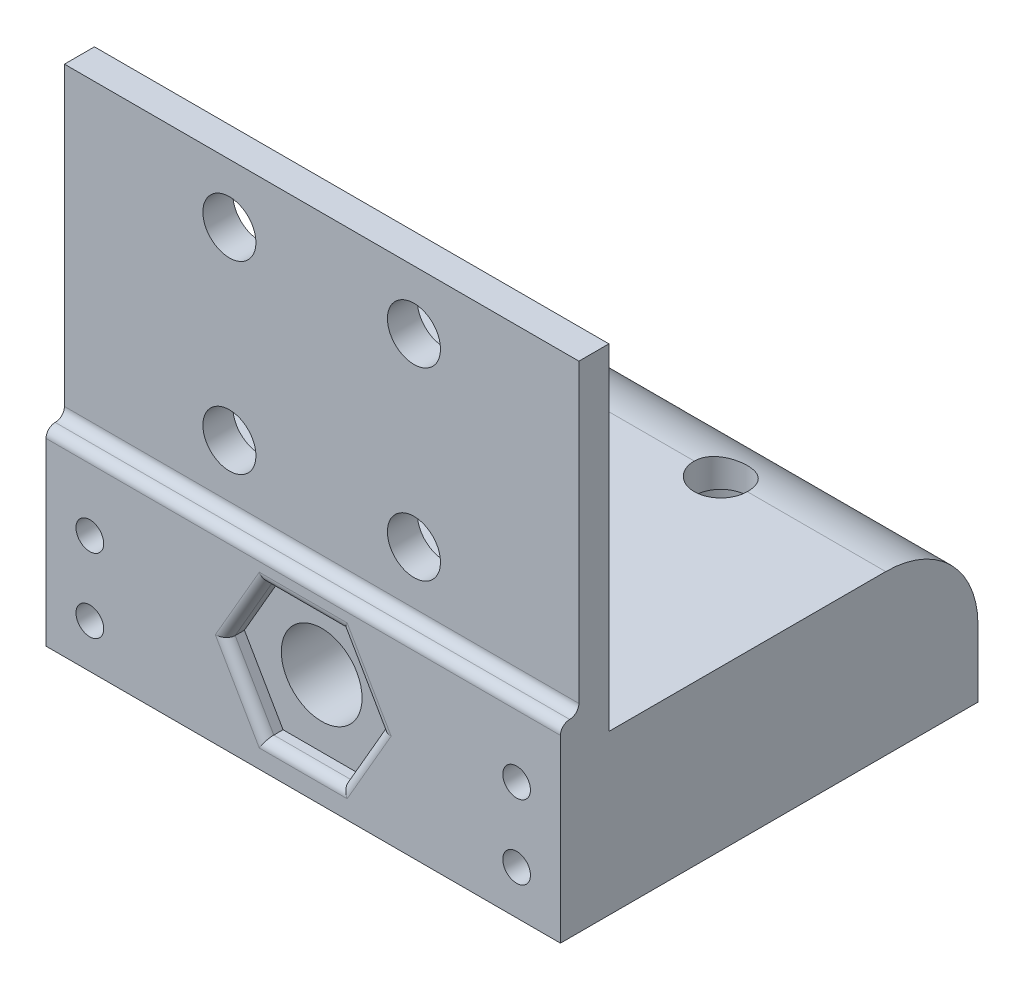
from build123d import *
from build123d.topology import SkipClean

# Parameters (mm, degrees)
SKETCH1_R           = 2.875
SKETCH1_W           = 55.75
SKETCH1_H           = 3.25
BOSS_EXTRUDE1_DEPTH = 3.25
SKETCH1_4_W         = 55.75
SKETCH1_4_H         = 3.25
BOSS_EXTRUDE2_DEPTH = 40
CUT_EXTRUDE2_DEPTH  = 43.25
BOSS_EXTRUDE4_DEPTH = 2
BOSS_EXTRUDE5_DEPTH = 43.25
SKETCH2_R           = 5
SKETCH2_R_2         = 2.875
CUT_EXTRUDE1_DEPTH  = 17.25
FILLET1_R           = 1
SKETCH2_3_R         = 5
SKETCH2_3_R_2       = 2.875
BOSS_EXTRUDE6_DEPTH = 3.25
SKETCH4_R           = 1.5
CUT_EXTRUDE4_DEPTH  = 45.25
FILLET4_R           = 1
FILLET5_R           = 10


# Some blends are built 0.0001 mm under size
with BuildPart() as part:
    # Sketch1 → Boss-Extrude1 (new body)
    # profile 1 of 2: a face of its own
    with BuildSketch(Plane.XY):
        Polygon((-17.875, -10), (37.875, -10), (37.875, -6.375), (37.875, 26.375), (-17.875, 26.375), (-17.875, -6.375), align=None)
        with Locations(Location((20, 20, 0), (0, 0, 180))):
            Circle(SKETCH1_R, mode=Mode.SUBTRACT)
        with Locations(Location((20, 0, 0), (0, 0, 180))):
            Circle(SKETCH1_R, mode=Mode.SUBTRACT)
        with Locations(Location((0, 0, 0), (0, 0, 180))):
            Circle(SKETCH1_R, mode=Mode.SUBTRACT)
        with Locations(Location((0, 20, 0), (0, 0, 180))):
            Circle(SKETCH1_R, mode=Mode.SUBTRACT)
    # profile 2 of 2: a face of its own
    with BuildSketch(Plane.XY):
        with Locations((10, -11.625)):
            Rectangle(SKETCH1_W, SKETCH1_H)
    extrude(amount=BOSS_EXTRUDE1_DEPTH)

    # Sketch1<4> → Boss-Extrude2 (add)
    with BuildSketch(Plane.XY):
        with Locations((10, -11.625)):
            Rectangle(SKETCH1_4_W, SKETCH1_4_H)
    extrude(amount=-BOSS_EXTRUDE2_DEPTH)

    # Sketch3 → Cut-Extrude2 (cut)
    with BuildSketch(Plane.XY.offset(3.25)):
        with BuildLine():
            Line((12.253469547, -13.25), (7.746530453, -13.25))
            ThreePointArc((7.746530453, -13.25), (7.84573728, -20.807857289), (14.375, -17))
            ThreePointArc((14.375, -17), (13.807857289, -14.84573728), (12.253469547, -13.25))
        make_face()
        with BuildLine():
            ThreePointArc((12.253469547, -13.25), (10, -12.625), (7.746530453, -13.25))
            Line((7.746530453, -13.25), (12.253469547, -13.25))
        make_face()
    extrude(amount=-CUT_EXTRUDE2_DEPTH, mode=Mode.SUBTRACT)

    # Sketch3<4> → Boss-Extrude4 (add)
    with BuildSketch(Plane.XY.offset(3.25)):
        Polygon((3.793484606, -13.25), (-17.875, -13.25), (-17.875, -27.25), (37.875, -27.25), (37.875, -13.25), (16.206515394, -13.25), (18.371578903, -17), (14.185789452, -24.25), (5.814210548, -24.25), (1.628421097, -17), align=None)
        Polygon((37.875, -6.75), (-17.875, -6.75), (-17.875, -13.25), (3.793484606, -13.25), (5.814210548, -9.75), (14.185789452, -9.75), (16.206515394, -13.25), (37.875, -13.25), align=None)
    extrude(amount=BOSS_EXTRUDE4_DEPTH)

    # Sketch3<5> → Boss-Extrude5 (add)
    with SkipClean():  # the faces are left unmerged after this step: merging them gives an invalid solid
        with BuildSketch(Plane.XY.offset(3.25)):
            Polygon((3.793484606, -13.25), (-17.875, -13.25), (-17.875, -27.25), (37.875, -27.25), (37.875, -13.25), (16.206515394, -13.25), (18.371578903, -17), (14.185789452, -24.25), (5.814210548, -24.25), (1.628421097, -17), align=None)
            with BuildLine():
                Line((7.746530453, -13.25), (3.793484606, -13.25))
                Line((3.793484606, -13.25), (1.628421097, -17))
                Line((1.628421097, -17), (5.814210548, -24.25))
                Line((5.814210548, -24.25), (14.185789452, -24.25))
                Line((14.185789452, -24.25), (18.371578903, -17))
                Line((18.371578903, -17), (16.206515394, -13.25))
                Line((16.206515394, -13.25), (12.253469547, -13.25))
                ThreePointArc((12.253469547, -13.25), (13.807857289, -14.84573728), (14.375, -17))
                ThreePointArc((14.375, -17), (7.84573728, -20.807857289), (7.746530453, -13.25))
            make_face()
        extrude(amount=-BOSS_EXTRUDE5_DEPTH)

    # Sketch2 → Cut-Extrude1 (cut)
    # profile 1 of 8: a face of its own
    with SkipClean():  # the faces are left unmerged after this step: merging them gives an invalid solid
        with BuildSketch(Plane.XZ.offset(10)):
            with Locations(Location((20, -10, 0), (0, 0, 90))):
                Circle(SKETCH2_R)
            with Locations((20, -10)):
                Circle(SKETCH2_R_2, mode=Mode.SUBTRACT)
        # profile 2 of 8: a face of its own
        with BuildSketch(Plane.XZ.offset(10)):
            with Locations((20, -10)):
                Circle(SKETCH2_R_2)
        # profile 3 of 8: a face of its own
        with BuildSketch(Plane.XZ.offset(10)):
            with Locations(Location((0, -10, 0), (0, 0, 90))):
                Circle(SKETCH2_R)
            with Locations((0, -10)):
                Circle(SKETCH2_R_2, mode=Mode.SUBTRACT)
        # profile 4 of 8: a face of its own
        with BuildSketch(Plane.XZ.offset(10)):
            with Locations((0, -10)):
                Circle(SKETCH2_R_2)
        # profile 5 of 8: a face of its own
        with BuildSketch(Plane.XZ.offset(10)):
            with Locations(Location((0, -30, 0), (0, 0, 90))):
                Circle(SKETCH2_R)
            with Locations((0, -30)):
                Circle(SKETCH2_R_2, mode=Mode.SUBTRACT)
        # profile 6 of 8: a face of its own
        with BuildSketch(Plane.XZ.offset(10)):
            with Locations((0, -30)):
                Circle(SKETCH2_R_2)
        # profile 7 of 8: a face of its own
        with BuildSketch(Plane.XZ.offset(10)):
            with Locations(Location((20, -30, 0), (0, 0, 90))):
                Circle(SKETCH2_R)
            with Locations((20, -30)):
                Circle(SKETCH2_R_2, mode=Mode.SUBTRACT)
        # profile 8 of 8: a face of its own
        with BuildSketch(Plane.XZ.offset(10)):
            with Locations((20, -30)):
                Circle(SKETCH2_R_2)
        extrude(amount=CUT_EXTRUDE1_DEPTH, mode=Mode.SUBTRACT)

    # Fillet1
    fillet1_edges = [part.edges().sort_by_distance(p)[0] for p in [
        (10, -6.75, 3.25),
    ]]
    fillet(fillet1_edges, radius=FILLET1_R)
    fillet1_2_edges = [part.edges().sort_by_distance(p)[0] for p in [
        (10, -6.75, 5.25),
    ]]
    fillet(fillet1_2_edges, radius=FILLET1_R - 0.0001)  # a hair under: the kernel refuses the full size

    # Sketch2<3> → Boss-Extrude6 (add)
    # profile 1 of 4: a face of its own
    with BuildSketch(Plane.XZ.offset(10)):
        with Locations(Location((20, -10, 0), (0, 0, 90))):
            Circle(SKETCH2_3_R)
        with Locations(Location((20, -10, 0), (0, 0, 90))):
            Circle(SKETCH2_3_R_2, mode=Mode.SUBTRACT)
    # profile 2 of 4: a face of its own
    with BuildSketch(Plane.XZ.offset(10)):
        with Locations(Location((0, -10, 0), (0, 0, 90))):
            Circle(SKETCH2_3_R)
        with Locations(Location((0, -10, 0), (0, 0, 90))):
            Circle(SKETCH2_3_R_2, mode=Mode.SUBTRACT)
    # profile 3 of 4: a face of its own
    with BuildSketch(Plane.XZ.offset(10)):
        with Locations(Location((0, -30, 0), (0, 0, 90))):
            Circle(SKETCH2_3_R)
        with Locations(Location((0, -30, 0), (0, 0, 90))):
            Circle(SKETCH2_3_R_2, mode=Mode.SUBTRACT)
    # profile 4 of 4: a face of its own
    with BuildSketch(Plane.XZ.offset(10)):
        with Locations(Location((20, -30, 0), (0, 0, 90))):
            Circle(SKETCH2_3_R)
        with Locations(Location((20, -30, 0), (0, 0, 90))):
            Circle(SKETCH2_3_R_2, mode=Mode.SUBTRACT)
    extrude(amount=BOSS_EXTRUDE6_DEPTH)

    # Sketch4 → Cut-Extrude4 (cut)
    with BuildSketch(Plane.XY.offset(5.25)):
        with Locations((33.125, -22.5)):
            Circle(SKETCH4_R)
        with Locations((-13.125, -22.5)):
            Circle(SKETCH4_R)
        with Locations((-13.125, -14.5)):
            Circle(SKETCH4_R)
        with Locations((33.125, -14.5)):
            Circle(SKETCH4_R)
    extrude(amount=-CUT_EXTRUDE4_DEPTH, mode=Mode.SUBTRACT)

    # Fillet4
    fillet4_edges = [part.edges().sort_by_distance(p)[0] for p in [
        (3.721315823, -13.375, 5.25),
        (10, -9.75, 5.25),
        (16.278684177, -13.375, 5.25),
        (16.278684177, -20.625, 5.25),
        (10, -24.25, 5.25),
        (3.721315823, -20.625, 5.25),
    ]]
    fillet(fillet4_edges, radius=FILLET4_R)

    # Fillet5
    # the kernel refuses this fillet: 10 mm, written as the material it takes off along each edge
    with BuildSketch(Plane(origin=(62.875, -10, -40), x_dir=(0, -1, 0), z_dir=(-1, 0, 0))) as fillet5_piece_1:
        with BuildLine():
            CenterArc((FILLET5_R, FILLET5_R), FILLET5_R, 180, 90)
            Line((0, FILLET5_R), (0, 0))
            Line((0, 0), (FILLET5_R, 0))
        make_face()
    extrude(amount=105.75, mode=Mode.SUBTRACT)


solid = part.part
